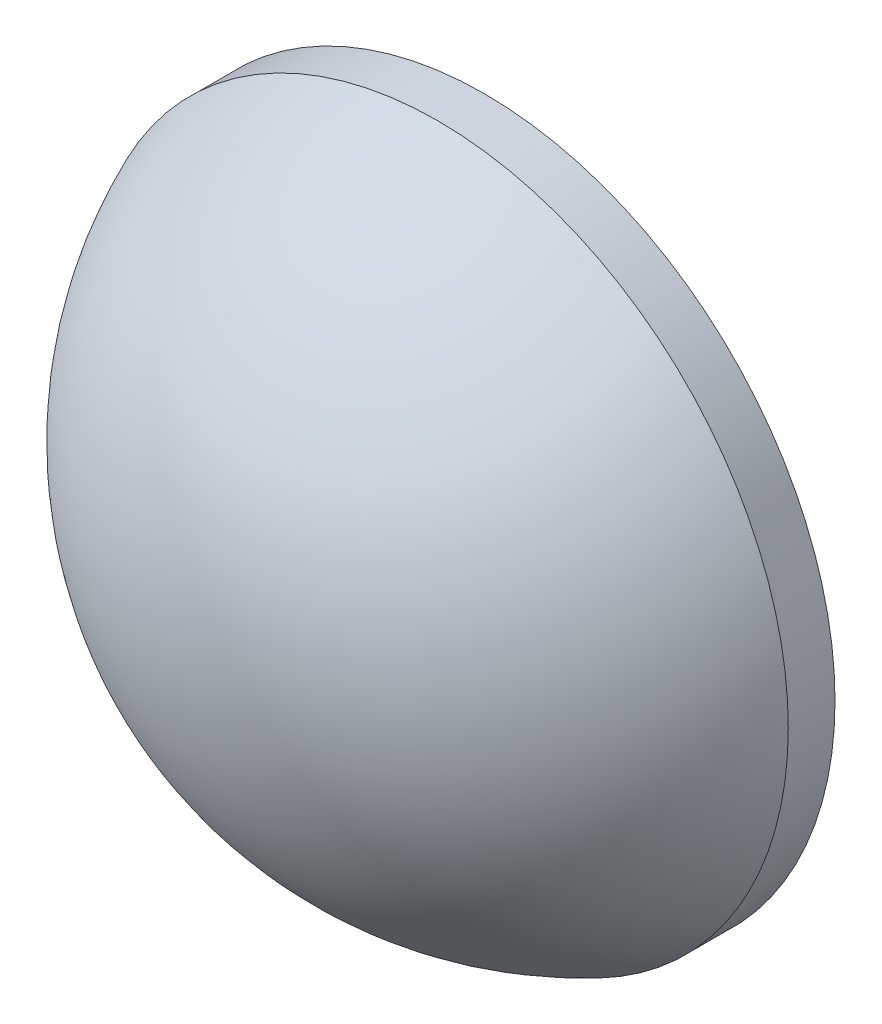
from build123d import *

# Parameters (mm, degrees)
SKETCH1_R           = 7.5
BOSS_EXTRUDE1_DEPTH = 1


# Read off the part's stored shape, not the designer's step: Dome1
with BuildPart() as part:
    # Sketch1 → Boss-Extrude1 (new body)
    with BuildSketch(Plane.XY):
        with Locations((-3.032398099, 0.551442744)):
            Circle(SKETCH1_R)
    extrude(amount=BOSS_EXTRUDE1_DEPTH)

    # Dome1 outline → Dome1 (revolve)
    with BuildSketch(Plane(origin=(-3.032398099, 0.551442744, 0), x_dir=(1, 0, 0), z_dir=(0, -1, 0))):
        with BuildLine():
            Line((0, 1), (7.500000003, 0.999999992))
            ThreePointArc((7.500000003, 0.999999992), (4.506939098, 4.635408639), (0, 6))
            Line((0, 6), (0, 1))
        make_face()
    revolve(axis=Axis((-3.032398099, 0.551442744, 0), (0, 0, 1)))


solid = part.part
